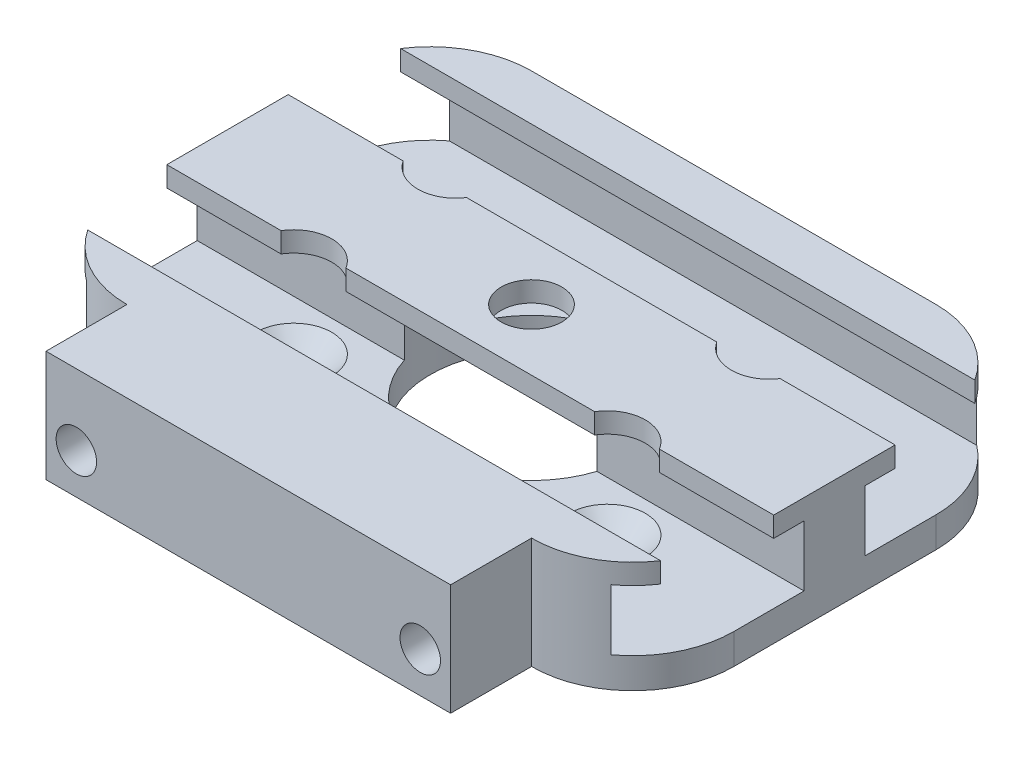
from build123d import *
from build123d.topology import SkipClean

# Parameters (mm, degrees)
SKETCH1_R           = 9.999999259
SKETCH1_R_2         = 1.748202303
SKETCH1_R_3         = 1.748202071
BOSS_EXTRUDE1_DEPTH = 3
BOSS_EXTRUDE2_REACH = 65.317
BOSS_EXTRUDE3_DEPTH = 59.999998659
CUT_EXTRUDE1_START  = 18
SKETCH3_R           = 9.999999259
CUT_EXTRUDE1_DEPTH  = 18
SKETCH4_W           = 63.792856733
SKETCH4_H           = 41.767533566
CUT_EXTRUDE2_DEPTH  = 29
SKETCH5_R           = 2.99999956
CUT_EXTRUDE3_DEPTH  = 29
CHAMFER1_SIZE       = 2
CHAMFER2_SIZE       = 2
SKETCH6_R           = 3.748202071
SKETCH6_R_2         = 3.748202303
CUT_EXTRUDE4_DEPTH  = 3
SKETCH7_R           = 1.5
CUT_EXTRUDE5_DEPTH  = 2
SKETCH9_W           = 40.000000969
SKETCH9_H           = 2
BOSS_EXTRUDE4_DEPTH = 11
SKETCH10_W          = 40.000000969
SKETCH10_H          = 10.999999914
SKETCH10_R          = 2
BOSS_EXTRUDE5_DEPTH = 6
CUT_EXTRUDE6_START  = -3.945921595
SKETCH10_3_R        = 2
CUT_EXTRUDE6_DEPTH  = 3.945921595


with BuildPart() as part:
    # Sketch1 → Boss-Extrude1 (new body)
    with BuildSketch(Plane(origin=(0, 0, 0), x_dir=(1, 0, 0), z_dir=(0, 1, 0))):
        with BuildLine():
            Line((-19.999999553, -20.000000484), (20.000001416, -20.000000484))
            ThreePointArc((20.000001416, -20.000000484), (27.071068604, -17.071068441), (29.999999329, -10.000000708))
            Line((29.999999329, -10.000000708), (29.999999329, 9.999998845))
            ThreePointArc((29.999999329, 9.999998845), (27.071068411, 17.071066386), (20.000001416, 19.999998622))
            Line((20.000001416, 19.999998622), (-19.999999553, 19.999998622))
            ThreePointArc((-19.999999553, 19.999998622), (-27.071067207, 17.071066499), (-29.999999329, 9.999998845))
            Line((-29.999999329, 9.999998845), (-29.999999329, -10.000000708))
            ThreePointArc((-29.999999329, -10.000000708), (-27.071067207, -17.071068362), (-19.999999553, -20.000000484))
        make_face()
        with Locations(Location((0, 0, 0), (0, 0, 270))):
            Circle(SKETCH1_R, mode=Mode.SUBTRACT)
        with Locations(Location((15.500057023, 8.001796436, 0), (0, 0, 270))):
            Circle(SKETCH1_R_2, mode=Mode.SUBTRACT)
        with Locations(Location((-15.500057023, 8.001796436, 0), (0, 0, 270))):
            Circle(SKETCH1_R_2, mode=Mode.SUBTRACT)
        with Locations(Location((-15.500057023, -7.998204092, 0), (0, 0, 270))):
            Circle(SKETCH1_R_3, mode=Mode.SUBTRACT)
        with Locations(Location((15.500057023, -7.998204092, 0), (0, 0, 270))):
            Circle(SKETCH1_R_3, mode=Mode.SUBTRACT)
    extrude(amount=BOSS_EXTRUDE1_DEPTH)

    # Boss-Extrude2: up to this face of the body (flat: up to its plane)
    boss_extrude2_end = Plane(part.part.faces().sort_by_distance((-29.999999329, 1.5, 9.31e-07))[0])
    # Sketch2 → Boss-Extrude2 (add, up to the picked face)
    with BuildSketch(Plane(origin=(29.999999329, 0, 0), x_dir=(0, 0, -1), z_dir=(1, 0, 0)), mode=Mode.PRIVATE) as boss_extrude2_sk1:
        Polygon((-6.054078553, 8.999999586), (-3.054078061, 8.999999586), (-3.054078061, 3), (2.94592106, 3), (2.94592106, 8.999999586), (5.945921552, 8.999999586), (5.945921552, 10.999999914), (-6.054078553, 10.999999914), align=None)
    boss_extrude2_tool1 = split(extrude(boss_extrude2_sk1.sketch, amount=-BOSS_EXTRUDE2_REACH, mode=Mode.PRIVATE), bisect_by=boss_extrude2_end, keep=Keep.BOTH, mode=Mode.PRIVATE)
    # Sketch2 → Boss-Extrude2 (add, up to the picked face)
    with BuildSketch(Plane(origin=(29.999999329, 0, 0), x_dir=(0, 0, -1), z_dir=(1, 0, 0)), mode=Mode.PRIVATE) as boss_extrude2_sk2:
        Polygon((-15.554079178, 10.999999914), (-20.000000484, 10.999999914), (-20.000000484, 3), (-18.05407889, 3), (-18.05407889, 8.999999586), (-15.554079178, 8.999999586), align=None)
    boss_extrude2_tool2 = split(extrude(boss_extrude2_sk2.sketch, amount=-BOSS_EXTRUDE2_REACH, mode=Mode.PRIVATE), bisect_by=boss_extrude2_end, keep=Keep.BOTH, mode=Mode.PRIVATE)
    # Sketch2 → Boss-Extrude2 (add, up to the picked face)
    with BuildSketch(Plane(origin=(29.999999329, 0, 0), x_dir=(0, 0, -1), z_dir=(1, 0, 0)), mode=Mode.PRIVATE) as boss_extrude2_sk3:
        Polygon((19.737818007, 10.999999914), (15.445922178, 10.999999914), (15.445922178, 8.999999586), (17.945919793, 8.999999586), (17.945919793, 3), (19.872933217, 3), (19.872933217, 8.999999586), (19.737818007, 8.999999586), align=None)
    boss_extrude2_tool3 = split(extrude(boss_extrude2_sk3.sketch, amount=-BOSS_EXTRUDE2_REACH, mode=Mode.PRIVATE), bisect_by=boss_extrude2_end, keep=Keep.BOTH, mode=Mode.PRIVATE)
    add(boss_extrude2_tool1.solids().sort_by(Axis((29.999999, 7.6, 0.054079), (-1, 0, 0)))[0])
    add(boss_extrude2_tool2.solids().sort_by(Axis((29.999999, 7.72931, 18.48663), (-1, 0, 0)))[0])
    add(boss_extrude2_tool3.solids().sort_by(Axis((29.999999, 7.704328, -18.348039), (-1, 0, 0)))[0])

    # Sketch2<3> → Boss-Extrude3 (add)
    with BuildSketch(Plane(origin=(29.999999329, 0, 0), x_dir=(0, 0, -1), z_dir=(1, 0, 0))):
        Polygon((19.945920121, 10.999999914), (19.737818007, 10.999999914), (19.737818007, 8.999999586), (19.872933217, 8.999999586), (19.945920121, 8.999999586), align=None)
        Polygon((19.999998622, 10.999999914), (19.945920121, 10.999999914), (19.945920121, 8.999999586), (19.872933217, 8.999999586), (19.872933217, 3), (19.999998622, 3), align=None)
    extrude(amount=-BOSS_EXTRUDE3_DEPTH)

    # Sketch3 → Cut-Extrude1 (cut)
    with SkipClean():  # the faces are left unmerged after this step: merging them gives an invalid solid
        with BuildSketch(Plane.XZ.offset(-8.999999586).offset(CUT_EXTRUDE1_START)):
            with Locations(Location((0, 0, 0), (0, 0, 342.86691881))):
                Circle(SKETCH3_R)
        extrude(amount=-CUT_EXTRUDE1_DEPTH, mode=Mode.SUBTRACT)
    add(part.part.scale(1), mode=Mode.REPLACE)  # the faces are merged on a copy

    # Sketch4 → Cut-Extrude2 (cut)
    with BuildSketch(Plane.XZ):
        with Locations((1.275857135, -0.402901322)):
            Rectangle(SKETCH4_W, SKETCH4_H)
        with BuildLine():
            Line((20.000001416, 20.000000484), (-19.999999553, 20.000000484))
            ThreePointArc((-19.999999553, 20.000000484), (-27.071067207, 17.071068362), (-29.999999329, 10.000000708))
            Line((-29.999999329, 10.000000708), (-29.999999329, -9.999998845))
            ThreePointArc((-29.999999329, -9.999998845), (-27.071067207, -17.071066499), (-19.999999553, -19.999998622))
            Line((-19.999999553, -19.999998622), (20.000001416, -19.999998622))
            ThreePointArc((20.000001416, -19.999998622), (27.071068411, -17.071066386), (29.999999329, -9.999998845))
            Line((29.999999329, -9.999998845), (29.999999329, 10.000000708))
            ThreePointArc((29.999999329, 10.000000708), (27.071068604, 17.071068441), (20.000001416, 20.000000484))
        make_face(mode=Mode.SUBTRACT)
    extrude(amount=-CUT_EXTRUDE2_DEPTH, mode=Mode.SUBTRACT)

    # Sketch5 → Cut-Extrude3 (cut)
    with BuildSketch(Plane(origin=(0, 10.999999914, 0), x_dir=(1, 0, 0), z_dir=(0, 1, 0))):
        with Locations(Location((0, 0, 0), (0, 0, 270))):
            Circle(SKETCH5_R)
    extrude(amount=-CUT_EXTRUDE3_DEPTH, mode=Mode.SUBTRACT)

    # Chamfer1
    chamfer1_edges = [part.edges().sort_by_distance(p)[0] for p in [
        (-15.500057023, 3, 6.250002021),
    ]]
    chamfer(chamfer1_edges, length=CHAMFER1_SIZE)

    # Chamfer2
    chamfer2_edges = [part.edges().sort_by_distance(p)[0] for p in [
        (15.500057023, 3, -9.749998739),
        (-15.500057023, 3, -9.749998739),
        (15.500057023, 3, 6.250002021),
    ]]
    chamfer(chamfer2_edges, length=CHAMFER2_SIZE)

    # Sketch6 → Cut-Extrude4 (cut)
    with BuildSketch(Plane(origin=(0, 10.999999914, 0), x_dir=(1, 0, 0), z_dir=(0, 1, 0))):
        with Locations((-15.500057023, -7.998204092)):
            Circle(SKETCH6_R)
        with Locations((-15.500057023, 8.001796436)):
            Circle(SKETCH6_R_2)
        with Locations((15.500057023, -7.998204092)):
            Circle(SKETCH6_R)
        with Locations((15.500057023, 8.001796436)):
            Circle(SKETCH6_R_2)
    extrude(amount=-CUT_EXTRUDE4_DEPTH, mode=Mode.SUBTRACT)

    # Sketch7 → Cut-Extrude5 (cut)
    with BuildSketch(Plane.XY.offset(20.000000484)):
        with Locations((-17, 3.999999914)):
            Circle(SKETCH7_R)
        with Locations((17, 3.999999914)):
            Circle(SKETCH7_R)
    extrude(amount=-CUT_EXTRUDE5_DEPTH, mode=Mode.SUBTRACT)

    # Sketch9 → Boss-Extrude4 (add)
    with BuildSketch(Plane(origin=(0, 10.999999914, 0), x_dir=(1, 0, 0), z_dir=(0, 1, 0))):
        with Locations((9.31e-07, -21.000000484)):
            Rectangle(SKETCH9_W, SKETCH9_H)
    extrude(amount=-BOSS_EXTRUDE4_DEPTH)

    # Sketch10 → Boss-Extrude5 (add)
    with BuildSketch(Plane.XY.offset(22.000000484)):
        with Locations((9.31e-07, 5.499999957)):
            Rectangle(SKETCH10_W, SKETCH10_H)
        with Locations((-17, 3.999999914)):
            Circle(SKETCH10_R, mode=Mode.SUBTRACT)
        with Locations((17, 3.999999914)):
            Circle(SKETCH10_R, mode=Mode.SUBTRACT)
    extrude(amount=BOSS_EXTRUDE5_DEPTH)

    # Sketch10<3> → Cut-Extrude6 (cut)
    with BuildSketch(Plane.XY.offset(22.000000484).offset(CUT_EXTRUDE6_START)):
        with Locations(Location((17, 3.999999914, 0), (0, 0, 209.999997166))):
            Circle(SKETCH10_3_R)
        with Locations(Location((-17, 3.999999914, 0), (0, 0, 209.999997166))):
            Circle(SKETCH10_3_R)
    extrude(amount=CUT_EXTRUDE6_DEPTH, mode=Mode.SUBTRACT)


solid = part.part
